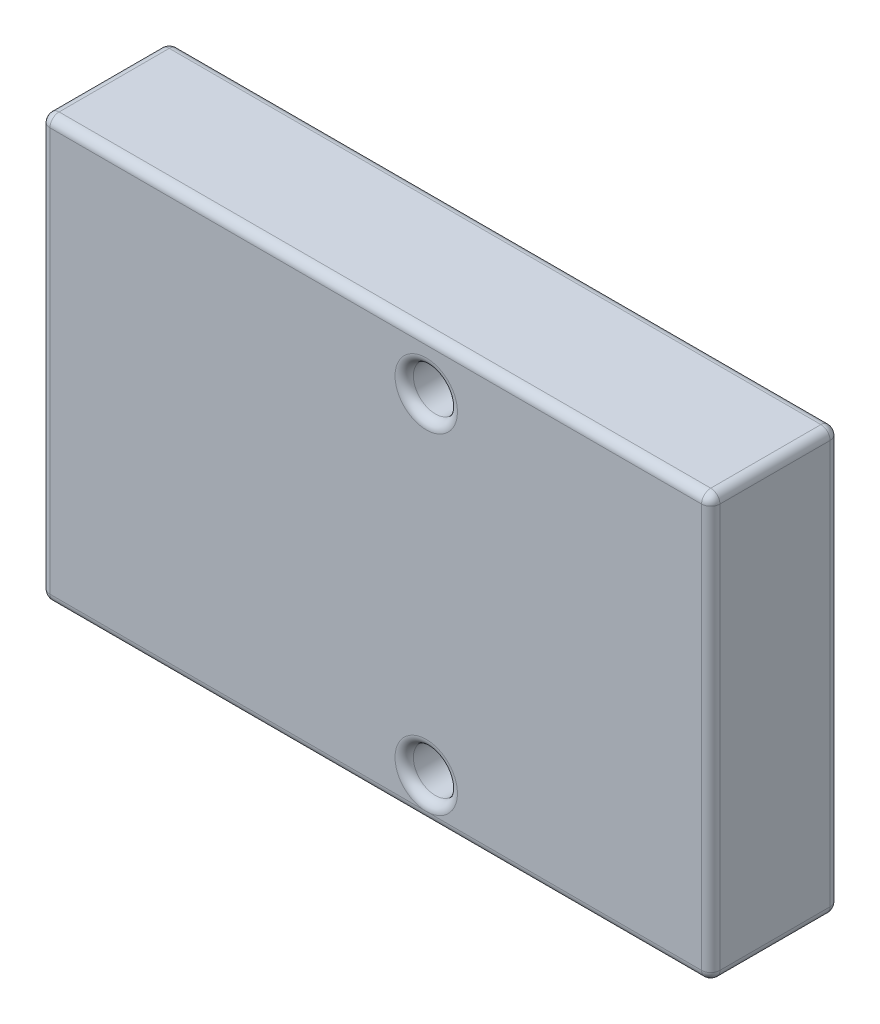
from build123d import *

# Parameters (mm, degrees)
SKETCH1_W           = 36.5
SKETCH1_H           = 7
BOSS_EXTRUDE1_DEPTH = 23
SKETCH2_R           = 1.375
CUT_EXTRUDE1_DEPTH  = 8.5
SKETCH4_R           = 1.2
CUT_EXTRUDE2_DEPTH  = 7
FILLET1_R           = 0.5


with BuildPart() as part:
    # Sketch1 → Boss-Extrude1 (new body)
    with BuildSketch(Plane(origin=(0, 0, 0), x_dir=(1, 0, 0), z_dir=(0, 1, 0))):
        with Locations((18.25, -3.5)):
            Rectangle(SKETCH1_W, SKETCH1_H)
    extrude(amount=BOSS_EXTRUDE1_DEPTH)

    # Sketch2 → Cut-Extrude1 (cut)
    with BuildSketch(Plane.XZ):
        with Locations(Location((8, 3, 0), (0, 0, 270))):
            Circle(SKETCH2_R)
        with Locations(Location((28.5, 3, 0), (0, 0, 270))):
            Circle(SKETCH2_R)
    extrude(amount=-CUT_EXTRUDE1_DEPTH, mode=Mode.SUBTRACT)

    # Sketch4 → Cut-Extrude2 (cut)
    with BuildSketch(Plane(origin=(0, 0, 0), x_dir=(-1, 0, 0), z_dir=(0, 0, -1))):
        with Locations((-21, 2.2)):
            Circle(SKETCH4_R)
        with Locations((-21, 20.2)):
            Circle(SKETCH4_R)
    extrude(amount=-CUT_EXTRUDE2_DEPTH, mode=Mode.SUBTRACT)

    # Fillet1
    fillet1_edges = [part.edges().sort_by_distance(p)[0] for p in [
        (36.5, 23, 3.5),
        (8, 0, 4.375),
        (18.25, 23, 0),
        (28.5, 0, 4.375),
        (22.2, 2.2, 7),
        (22.2, 2.2, 0),
        (22.2, 20.2, 7),
        (22.2, 20.2, 0),
        (0, 23, 3.5),
        (18.25, 0, 0),
        (36.5, 0, 3.5),
        (18.25, 0, 7),
        (0, 0, 3.5),
        (0, 11.5, 0),
        (36.5, 11.5, 0),
        (36.5, 11.5, 7),
        (0, 11.5, 7),
        (18.25, 23, 7),
    ]]
    fillet(fillet1_edges, radius=FILLET1_R - 0.0001)  # a hair under: the kernel refuses the full size


solid = part.part
